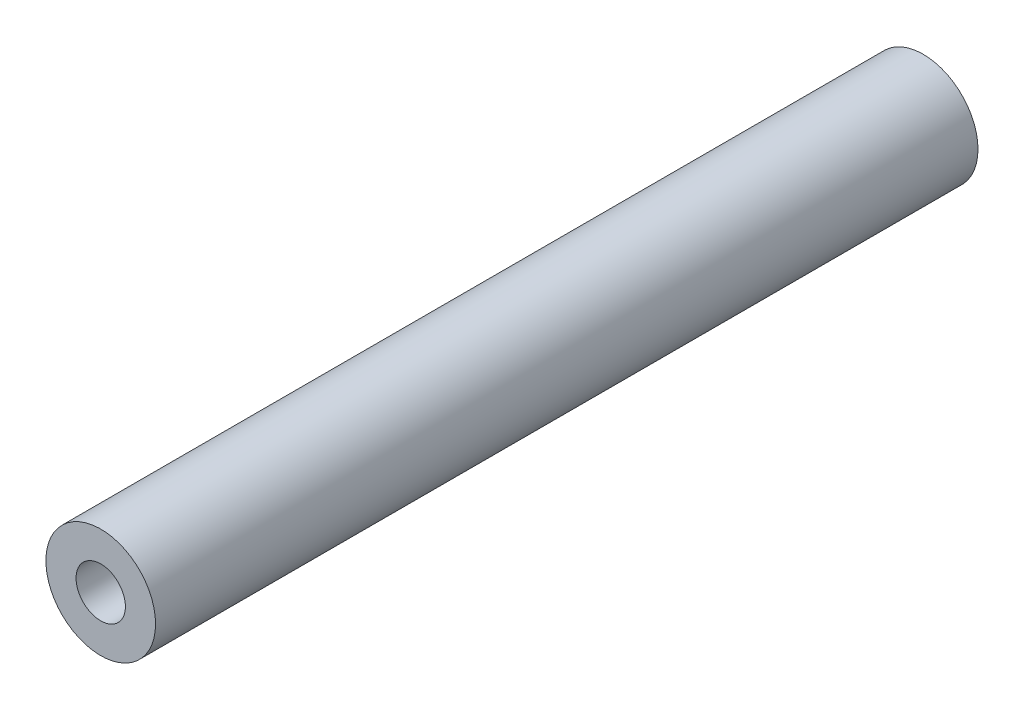
from build123d import *

# Parameters (mm, degrees)
SKETCH1_R           = 5
BOSS_EXTRUDE1_DEPTH = 75
SKETCH2_R           = 2.25
CUT_EXTRUDE1_DEPTH  = 12


with BuildPart() as part:
    # Sketch1 → Boss-Extrude1 (new body)
    with BuildSketch(Plane.XY):
        Circle(SKETCH1_R)
    extrude(amount=BOSS_EXTRUDE1_DEPTH)

    # Sketch2 → Cut-Extrude1 (cut)
    with BuildSketch(Plane.XY.offset(75)):
        Circle(SKETCH2_R)
    extrude(amount=-CUT_EXTRUDE1_DEPTH, mode=Mode.SUBTRACT)


solid = part.part
